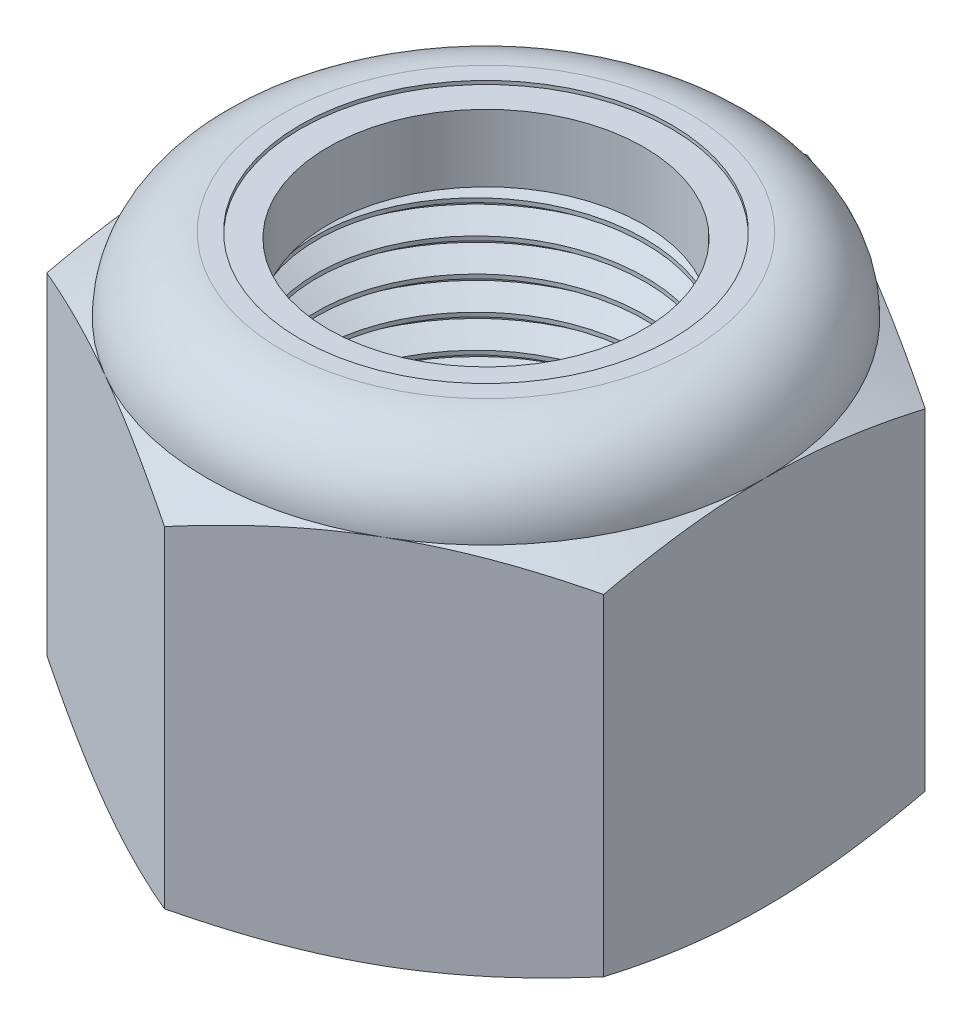
from build123d import *

# Parameters (mm, degrees)
SKETCH13_R       = 7.9375
EXTRUDE1_DEPTH   = 19.05
SKETCH2_W        = 7.9375
SKETCH2_H        = 15.875
CUT_SWEEP1_PITCH = 1.411111111
SKETCH12_W       = 8.73125
SKETCH12_H       = 15.875


with BuildPart() as part:
    # Sketch13 → Extrude1 (new body)
    with BuildSketch(Plane(origin=(0, 0, 0), x_dir=(1, 0, 0), z_dir=(0, 1, 0))):
        Polygon((0, 13.748153285), (-11.90625, 6.874076643), (-11.90625, -6.874076643), (0, -13.748153285), (11.90625, -6.874076643), (11.90625, 6.874076643), align=None)
        with Locations(Location((0, 0, 0), (0, 0, 270))):
            Circle(SKETCH13_R, mode=Mode.SUBTRACT)
    extrude(amount=EXTRUDE1_DEPTH)

    # Sketch5 → Cut-Revolve3 (revolve, cut)
    with BuildSketch(Plane(origin=(0, 0, 0), x_dir=(0, 0, -1), z_dir=(1, 0, 0))):
        with BuildLine():
            Line((0, 0), (11.90625, 0))
            Line((11.90625, 0), (13.748153285, 0.858893607))
            Line((13.748153285, 0.858893607), (13.748153285, 15.016106393))
            Line((13.748153285, 15.016106393), (11.90625, 15.875))
            ThreePointArc((11.90625, 15.875), (10.97631403, 18.12006403), (8.73125, 19.05))
            Line((8.73125, 19.05), (8.73125, 20.32))
            Line((8.73125, 20.32), (15.018153285, 20.32))
            Line((15.018153285, 20.32), (15.018153285, -1.27))
            Line((15.018153285, -1.27), (0, -1.27))
            Line((0, -1.27), (0, 0))
        make_face()
    revolve(axis=Axis((0, 0, 0), (0, 1, 0)), mode=Mode.SUBTRACT)

    # Sketch6 → Cut-Revolve4 (revolve, cut)
    with BuildSketch(Plane(origin=(0, 0, 0), x_dir=(0, 0, -1), z_dir=(1, 0, 0)), mode=Mode.PRIVATE) as cut_revolve4_sk:
        with BuildLine():
            Line((0, 15.875), (11.75385, 15.875))
            ThreePointArc((11.75385, 15.875), (10.868550957, 18.012300957), (8.73125, 18.8976))
            Line((8.73125, 18.8976), (4.365625, 18.8976))
            Line((4.365625, 18.8976), (4.365625, 20.32))
            Line((4.365625, 20.32), (0, 20.32))
            Line((0, 20.32), (0, 15.875))
        make_face()
    revolve(cut_revolve4_sk.sketch.rotate(Axis((0, 20.32, 0), (0, -1, 0)), 180), axis=Axis((0, 20.32, 0), (0, -1, 0)), mode=Mode.SUBTRACT)

    # Sketch4 → Cut-Revolve2 (revolve, cut)
    with BuildSketch(Plane(origin=(0, 0, 0), x_dir=(0, 0, -1), z_dir=(1, 0, 0))):
        Polygon((0, 15.875), (8.73125, 15.875), (0, 11.80355126), align=None)
        Polygon((0, 4.07144874), (8.73125, 0), (0, 0), align=None)
    revolve(axis=Axis((0, 0, 0), (0, 1, 0)), mode=Mode.SUBTRACT)

    # Sketch12 → Revolve4 (revolve)
    with BuildSketch(Plane(origin=(0, 0, 0), x_dir=(0, 0, -1), z_dir=(1, 0, 0)), mode=Mode.PRIVATE) as revolve4_sk:
        with Locations((4.365625, 7.9375)):
            Rectangle(SKETCH12_W, SKETCH12_H)
    revolve(revolve4_sk.sketch.rotate(Axis((0, 0, 0), (0, 1, 0)), 4.598397943), axis=Axis((0, 0, 0), (0, 1, 0)))


with BuildPart() as body_2:
    # Sketch7 → Revolve2 (revolve)
    with BuildSketch(Plane(origin=(0, 0, 0), x_dir=(0, 0, -1), z_dir=(1, 0, 0))):
        with BuildLine():
            Line((6.746875, 15.9512), (11.67666449, 15.9512))
            ThreePointArc((11.67666449, 15.9512), (10.787552176, 17.985188219), (8.73125, 18.8214))
            Line((8.73125, 18.8214), (6.746875, 18.8214))
            Line((6.746875, 18.8214), (6.746875, 15.9512))
        make_face()
    revolve(axis=Axis((0, 15.9512, 0), (0, 1, 0)))


with BuildPart() as body_3:
    # Sketch2 → Revolve1 (revolve)
    with BuildSketch(Plane(origin=(0, 0, 0), x_dir=(0, 0, -1), z_dir=(1, 0, 0))):
        with Locations((3.96875, 7.9375)):
            Rectangle(SKETCH2_W, SKETCH2_H)
    revolve(axis=Axis((0, -7.9375, 0), (0, 1, 0)))

    # Cut-Sweep1: the profile of Sketch9 screwed along a right-hand helix of 14.5 turns, 8 arcs to a turn; built about Z, then put on its axis
    cut_sweep1_z = Axis((0, 0, 0), (0, 0, 1))
    cut_sweep1_corners = [(8.090257259, 0, 0.088194444), (8.013878629, 0, -1.278819444), (7.020956448, 0, -0.705555556), (7.020956448, 0, -0.529166667)]
    with BuildLine(mode=Mode.PRIVATE) as cut_sweep1_profile:
        Line(cut_sweep1_corners[0], cut_sweep1_corners[1])
        Line(cut_sweep1_corners[1], cut_sweep1_corners[2])
        Line(cut_sweep1_corners[2], cut_sweep1_corners[3])
        Line(cut_sweep1_corners[3], cut_sweep1_corners[0])
    cut_sweep1_cap = Face(cut_sweep1_profile.wire())
    cut_sweep1_turn_angles = [0, 22.5, 45, 67.5, 90, 112.5, 135, 157.5, 180, 202.5, 225, 247.5, 270, 292.5, 315, 337.5, 360]
    cut_sweep1_turn_weights = [1, 0.9238795325112867, 1, 0.9238795325112867, 1, 0.9238795325112867, 1, 0.9238795325112867, 1, 0.9238795325112867, 1, 0.9238795325112867, 1, 0.9238795325112867, 1, 0.9238795325112867, 1]
    cut_sweep1_turn_rails = [Edge.make_bspline([Vector(p[0], p[1], 0).rotate(cut_sweep1_z, cut_sweep1_turn_angles[k]) / cut_sweep1_turn_weights[k] + Vector(0, 0, p[2] + CUT_SWEEP1_PITCH * cut_sweep1_turn_angles[k] / 360) for k in range(17)], [0, 0, 0, 1, 1, 2, 2, 3, 3, 4, 4, 5, 5, 6, 6, 7, 7, 8, 8, 8], 2, cut_sweep1_turn_weights) for p in cut_sweep1_corners]
    cut_sweep1_turn_sides = [Face.make_surface_from_curves(cut_sweep1_turn_rails[p[0]], cut_sweep1_turn_rails[p[1]]) for p in [(0, 1), (1, 2), (2, 3), (3, 0)]]
    cut_sweep1_last_angles = [5040, 5062.5, 5085, 5107.5, 5130, 5152.5, 5175, 5197.5, 5220]
    cut_sweep1_last_weights = [1, 0.9238795325112867, 1, 0.9238795325112867, 1, 0.9238795325112867, 1, 0.9238795325114781, 1]
    cut_sweep1_last_rails = [Edge.make_bspline([Vector(p[0], p[1], 0).rotate(cut_sweep1_z, cut_sweep1_last_angles[k]) / cut_sweep1_last_weights[k] + Vector(0, 0, p[2] + CUT_SWEEP1_PITCH * cut_sweep1_last_angles[k] / 360) for k in range(9)], [0, 0, 0, 1, 1, 2, 2, 3, 3, 4, 4, 4], 2, cut_sweep1_last_weights) for p in cut_sweep1_corners]
    cut_sweep1_last_sides = [Face.make_surface_from_curves(cut_sweep1_last_rails[p[0]], cut_sweep1_last_rails[p[1]]) for p in [(0, 1), (1, 2), (2, 3), (3, 0)]]
    cut_sweep1 = Plane(origin=(0, 15.875, 0), x_dir=(0, 0, -1), z_dir=(0, -1, 0)) * Solid(Shell([*[p.moved(Location((0, 0, CUT_SWEEP1_PITCH * i))) for i in range(14) for p in cut_sweep1_turn_sides], *cut_sweep1_last_sides, cut_sweep1_cap, cut_sweep1_cap.rotate(cut_sweep1_z, 5220).moved(Location((0, 0, CUT_SWEEP1_PITCH * 5220 / 360)))]))
    add(cut_sweep1, mode=Mode.SUBTRACT)

    # Sketch11 → Revolve3 (revolve)
    with BuildSketch(Plane(origin=(0, 0, 0), x_dir=(0, 0, -1), z_dir=(1, 0, 0))):
        Polygon((0, 0), (8.73125, 0), (0, 4.07144874), align=None)
    revolve(axis=Axis((0, 19.05, 0), (0, -1, 0)))


with BuildPart() as part_1:
    add(part.part)

    # Combine1: cut body 3
    add(body_3.part, mode=Mode.SUBTRACT)


solid = Compound([body_2.part, part_1.part])
